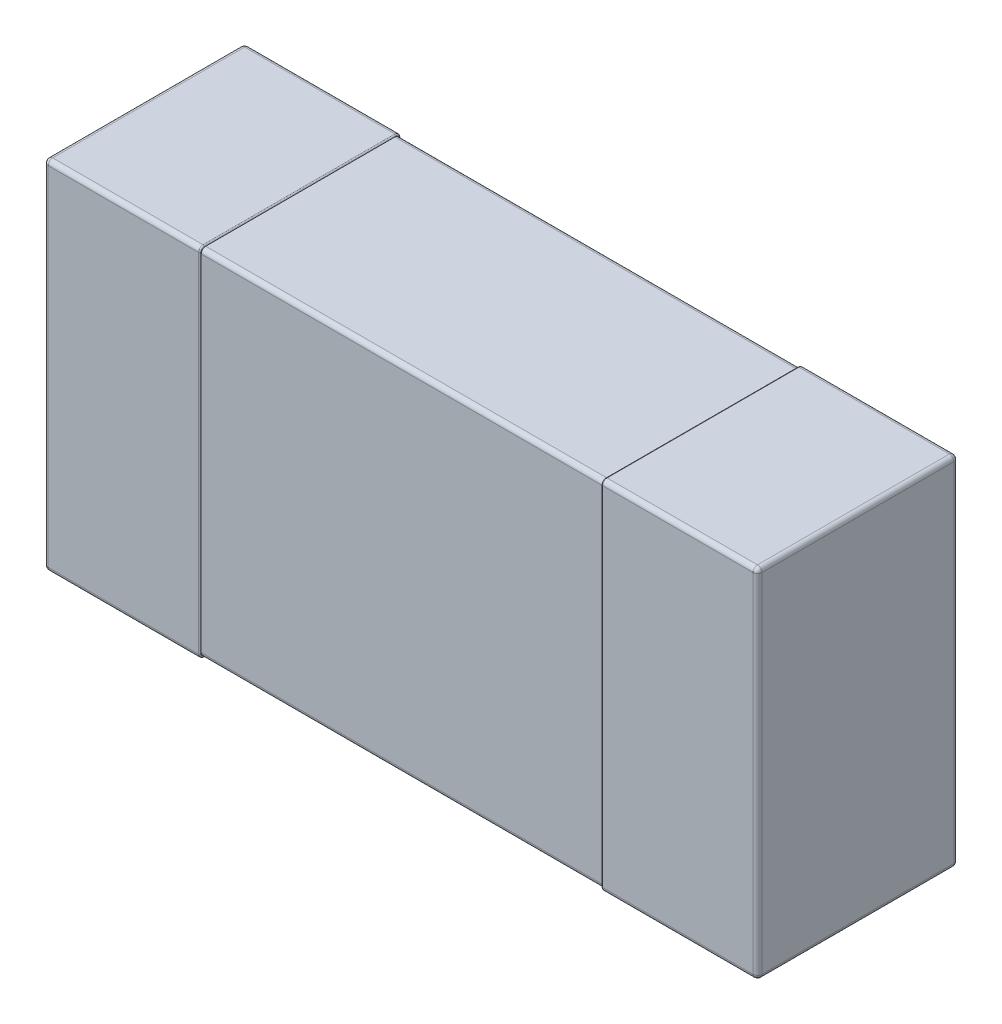
from build123d import *

# Parameters (mm, degrees)
SKETCH1_W                           = 1.6
SKETCH1_H                           = 0.8
ALL_BODY_DEPTH                      = 0.45
CUT_OUT_THE_BODY_FOR_PIN_DEPTH      = 0.45
CUT_OUT_THE_BODY_FOR_PIN_DEPTH_BACK = 0.45
SKETCH2_OUTSIDE_W                   = 2.818
SKETCH2_OUTSIDE_H                   = 3.168
SKETCH2_OUTSIDE_W_2                 = 0.444
SKETCH2_OUTSIDE_H_2                 = 0.794
BODY_FILLET_R                       = 0.01
PIN_FILLET_A_R                      = 0.01
PIN_FILLET_B_R                      = 0.003


with BuildPart() as part:
    # Sketch1 → All body (new body)
    with BuildSketch(Plane.XY):
        Rectangle(SKETCH1_W, SKETCH1_H)
    extrude(amount=ALL_BODY_DEPTH)

    # Sketch2 outside → Cut out the body for pin (cut, two sides: drawn at the far end of the back side and taken through both)
    with BuildSketch(Plane(origin=(0, 0, 0), x_dir=(0, 0, -1), z_dir=(1, 0, 0)).offset(-CUT_OUT_THE_BODY_FOR_PIN_DEPTH_BACK)):
        with Locations((-0.225, 0)):
            Rectangle(SKETCH2_OUTSIDE_W, SKETCH2_OUTSIDE_H)
        with Locations((-0.225, 0)):
            Rectangle(SKETCH2_OUTSIDE_W_2, SKETCH2_OUTSIDE_H_2, mode=Mode.SUBTRACT)
    extrude(amount=CUT_OUT_THE_BODY_FOR_PIN_DEPTH + CUT_OUT_THE_BODY_FOR_PIN_DEPTH_BACK, mode=Mode.SUBTRACT)

    # Body fillet
    body_fillet_edges = [part.edges().sort_by_distance(p)[0] for p in [
        (0, 0.397, 0.003),
        (0, 0.397, 0.447),
        (0, -0.397, 0.447),
        (0, -0.397, 0.003),
    ]]
    fillet(body_fillet_edges, radius=BODY_FILLET_R)

    # Pin fillet a
    pin_fillet_a_edges = [part.edges().sort_by_distance(p)[0] for p in [
        (0.8, 0, 0.45),
        (-0.625, 0.4, 0),
        (0.625, -0.4, 0),
        (0.625, -0.4, 0.45),
        (-0.625, 0.4, 0.45),
        (0.625, 0.4, 0.45),
        (-0.8, 0, 0.45),
        (0.625, 0.4, 0),
        (0.8, 0, 0),
        (-0.625, -0.4, 0),
        (-0.8, 0, 0),
        (-0.8, 0.4, 0.225),
        (0.8, 0.4, 0.225),
        (0.8, -0.4, 0.225),
        (-0.8, -0.4, 0.225),
        (-0.625, -0.4, 0.45),
    ]]
    fillet(pin_fillet_a_edges, radius=PIN_FILLET_A_R)

    # Pin fillet b
    pin_fillet_b_edges = [part.edges().sort_by_distance(p)[0] for p in [
        (0.45, -0.4, 0.225),
        (0.45, 0, 0.45),
        (0.45, 0.4, 0.225),
        (0.45, 0, 0),
        (-0.45, 0.4, 0.225),
        (-0.45, 0, 0.45),
        (-0.45, -0.4, 0.225),
        (-0.45, 0, 0),
        (0.45, 0.397071068, 0.002928932),
        (0.45, -0.397071068, 0.002928932),
        (0.45, -0.397071068, 0.447071068),
        (0.45, 0.397071068, 0.447071068),
        (-0.45, -0.397071068, 0.447071068),
        (-0.45, 0.397071068, 0.447071068),
        (-0.45, -0.397071068, 0.002928932),
        (-0.45, 0.397071068, 0.002928932),
    ]]
    fillet(pin_fillet_b_edges, radius=PIN_FILLET_B_R - 0.0001)  # a hair under: the kernel refuses the full size


solid = part.part
